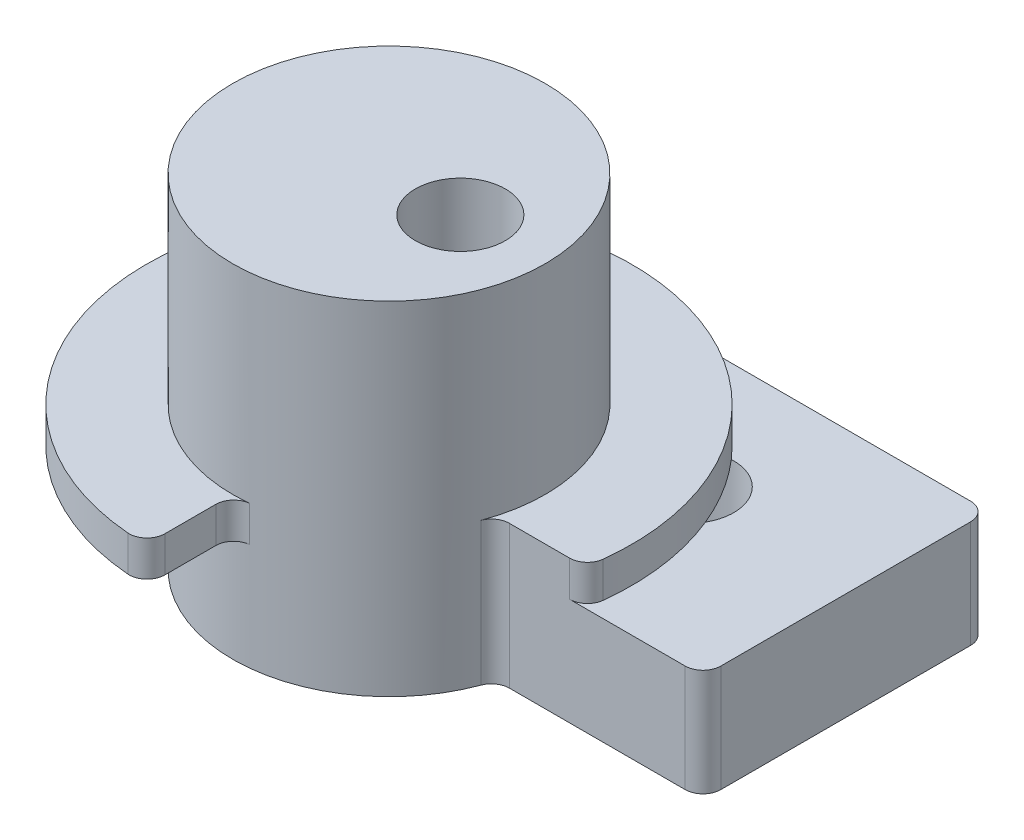
from build123d import *

# Parameters (mm, degrees)
SKETCH2_W           = 4.7625
SKETCH2_H           = 6.95
SKETCH2_W_2         = 1.5875
SKETCH2_H_2         = 3.845
SKETCH2_W_3         = 17.78
SKETCH3_R           = 11.338051479
CUT_EXTRUDE1_DEPTH  = 21.336
SKETCH5_R           = 2
CUT_EXTRUDE3_DEPTH  = 27.432
BOSS_EXTRUDE2_START = -4.7625
SKETCH5_3_R         = 2
BOSS_EXTRUDE2_DEPTH = 4.7625
FILLET1_R           = 0.79375
CUT_EXTRUDE4_START  = -14.224
CUT_EXTRUDE4_DEPTH  = 14.224
FILLET2_R           = 0.79375


with BuildPart() as part:
    # Sketch2 → Revolve2 (revolve)
    with BuildSketch(Plane(origin=(0, 0, 0), x_dir=(0, 1, 0), z_dir=(0, 0, 1)), mode=Mode.PRIVATE) as revolve2_sk:
        with Locations((-12.85875, 3.475)):
            Rectangle(SKETCH2_W, SKETCH2_H)
        with Locations((-9.68375, 3.475)):
            Rectangle(SKETCH2_W_2, SKETCH2_H)
        with Locations((-9.68375, 8.8725)):
            Rectangle(SKETCH2_W_2, SKETCH2_H_2)
        with Locations((0, 3.475)):
            Rectangle(SKETCH2_W_3, SKETCH2_H)
        with Locations((9.68375, 3.475)):
            Rectangle(SKETCH2_W_2, SKETCH2_H)
        with Locations((9.68375, 8.8725)):
            Rectangle(SKETCH2_W_2, SKETCH2_H_2)
        with Locations((12.85875, 3.475)):
            Rectangle(SKETCH2_W, SKETCH2_H)
    revolve(revolve2_sk.sketch.rotate(Axis((0, -15.24, 0), (0, 1, 0)), 180), axis=Axis((0, -15.24, 0), (0, 1, 0)))

    # Sketch3 → Cut-Extrude1 (cut)
    with BuildSketch(Plane(origin=(0, 0, 0), x_dir=(-1, 0, 0), z_dir=(0, 1, 0))):
        Circle(SKETCH3_R)
    extrude(amount=-CUT_EXTRUDE1_DEPTH, mode=Mode.SUBTRACT)

    # Sketch5 → Cut-Extrude3 (cut)
    with BuildSketch(Plane(origin=(0, 15.24, 0), x_dir=(-1, 0, 0), z_dir=(0, 1, 0))):
        with Locations((-3.175, 0)):
            Circle(SKETCH5_R)
        with BuildLine():
            ThreePointArc((-1.175, 0), (-1.559736192, 1.179373914), (-2.565922829, 1.905))
            Line((-2.565922829, 1.905), (-3.784077171, 1.905))
            ThreePointArc((-3.784077171, 1.905), (-4.354373914, -1.615263808), (-1.175, 0))
        make_face()
        with BuildLine():
            Line((-3.784077171, 1.905), (-2.565922829, 1.905))
            ThreePointArc((-2.565922829, 1.905), (-3.175, 2), (-3.784077171, 1.905))
        make_face()
    extrude(amount=-CUT_EXTRUDE3_DEPTH, mode=Mode.SUBTRACT)

    # Sketch5<3> → Boss-Extrude2 (add)
    with BuildSketch(Plane(origin=(0, 15.24, 0), x_dir=(-1, 0, 0), z_dir=(0, 1, 0)).offset(BOSS_EXTRUDE2_START)):
        with BuildLine():
            Line((-15.875, -10.795), (0, -10.795))
            Line((0, -10.795), (0, -6.95))
            ThreePointArc((0, -6.95), (-5.547172703, -4.187048483), (-6.683821886, 1.905))
            Line((-6.683821886, 1.905), (-15.875, 1.905))
            Line((-15.875, 1.905), (-15.875, -10.795))
        make_face()
        with Locations((-8.255, -5.08)):
            Circle(SKETCH5_3_R, mode=Mode.SUBTRACT)
    extrude(amount=BOSS_EXTRUDE2_DEPTH)

    # Fillet1
    # the kernel refuses this fillet: 0.79375 mm, written as the material it adds along each edge
    with BuildSketch(Plane(origin=(0, 10.4775, -6.95), x_dir=(-0.9986823309895368, 0, 0.051318629846335534), z_dir=(0, 1, 0))) as fillet1_piece_1:
        with BuildLine():
            CenterArc((0.754063117, -0.7927041), FILLET1_R, 92.941633047, 84.116733906)
            Line((-0.038640983, -0.751969938), (0, 0))
            ThreePointArc((0, 0), (0.356664477, -0.0091578), (0.713328955, 0))
        make_face()
    extrude(amount=4.7625)
    with BuildSketch(Plane(origin=(6.683821886, 9.041391923, 1.905), x_dir=(1, 0, 0), z_dir=(0, 1, 0))) as fillet1_piece_2:
        with BuildLine():
            CenterArc((0.574443231, -0.79375), FILLET1_R, 90, 69.603984808)
            ThreePointArc((-0.169543589, -0.51712268), (-0.079708314, -0.26022145), (0, 0))
            Line((0, 0), (0.574443231, 0))
        make_face()
    extrude(amount=6.198608077)
    # the kernel refuses this fillet: 0.79375 mm, written as the material it takes off along each edge
    with BuildSketch(Plane(origin=(0, 10.4775, -10.795), x_dir=(1, 0, 0), z_dir=(0, 1, 0))) as fillet1_2_piece_1:
        with BuildLine():
            CenterArc((FILLET1_R, -FILLET1_R), FILLET1_R, 90, 90)
            Line((0, -FILLET1_R), (0, 0))
            Line((0, 0), (FILLET1_R, 0))
        make_face()
    extrude(amount=6.746875, mode=Mode.SUBTRACT)
    with BuildSketch(Plane(origin=(15.875, 8.493125, 1.905), x_dir=(0, 0, -1), z_dir=(0, 1, 0)), Plane(origin=(15.875, 8.493125, -10.795), x_dir=(-1, 0, 0), z_dir=(0, 1, 0))) as fillet1_2_piece_2:
        with BuildLine():
            CenterArc((FILLET1_R, FILLET1_R), FILLET1_R, 180, 90)
            Line((0, FILLET1_R), (0, 0))
            Line((0, 0), (FILLET1_R, 0))
        make_face()
    extrude(amount=8.73125, mode=Mode.SUBTRACT)

    # Sketch6 → Cut-Extrude4 (cut)
    with BuildSketch(Plane(origin=(0, 10.4775, 0), x_dir=(-1, 0, 0), z_dir=(0, 1, 0)).offset(CUT_EXTRUDE4_START)):
        with BuildLine():
            ThreePointArc((-6.514278297, 2.42212268), (-3.966657748, 5.70684907), (0, 6.95))
            Line((0, 6.95), (0, 10.795))
            ThreePointArc((0, 10.795), (-6.927032193, 8.279387055), (-10.625582337, 1.905))
            Line((-10.625582337, 1.905), (-7.258265116, 1.905))
            ThreePointArc((-7.258265116, 1.905), (-6.805238557, 2.046978568), (-6.514278297, 2.42212268))
        make_face()
    extrude(amount=CUT_EXTRUDE4_DEPTH, mode=Mode.SUBTRACT)

    # Fillet2
    # the kernel refuses this fillet: 0.79375 mm, written as the material it adds along each edge
    with BuildSketch(Plane(origin=(0, 8.89, 6.95), x_dir=(0.9986823309895368, 0, -0.051318629846333855), z_dir=(0, 1, 0))) as fillet2_piece_1:
        with BuildLine():
            CenterArc((0.754063117, -0.7927041), FILLET2_R, 92.941633047, 84.116733906)
            Line((-0.038640983, -0.751969938), (0, 0))
            ThreePointArc((0, 0), (0.356664477, -0.0091578), (0.713328955, 0))
        make_face()
    extrude(amount=1.5875)
    # the kernel refuses this fillet: 0.79375 mm, written as the material it takes off along each edge
    with BuildSketch(Plane(origin=(0, 6.746443854, 10.795), x_dir=(0, 0, -1), z_dir=(0, 1, 0))) as fillet2_2_piece_1:
        with BuildLine():
            CenterArc((0.825297773, 0.79375), FILLET2_R, 175.447928579, 94.552071421)
            ThreePointArc((0.034051564, 0.856746032), (0.00851625, 0.428711229), (0, 0))
            Line((0, 0), (0.825297773, 0))
        make_face()
    extrude(amount=5.874612291, mode=Mode.SUBTRACT)
    with BuildSketch(Plane(origin=(10.625582337, 7.107567927, 1.905), x_dir=(-1, 0, 0), z_dir=(0, 1, 0))) as fillet2_2_piece_2:
        with BuildLine():
            CenterArc((0.686260177, -0.79375), FILLET2_R, 90, 83.620629792)
            ThreePointArc((-0.102574915, -0.705555556), (-0.057113988, -0.351930706), (0, 0))
            Line((0, 0), (0.686260177, 0))
        make_face()
    extrude(amount=3.369932073, mode=Mode.SUBTRACT)


with BuildPart() as body_2:
    # Mirror1: mirrored copy
    add(part.part.mirror(Plane.ZX))


solid = body_2.part
